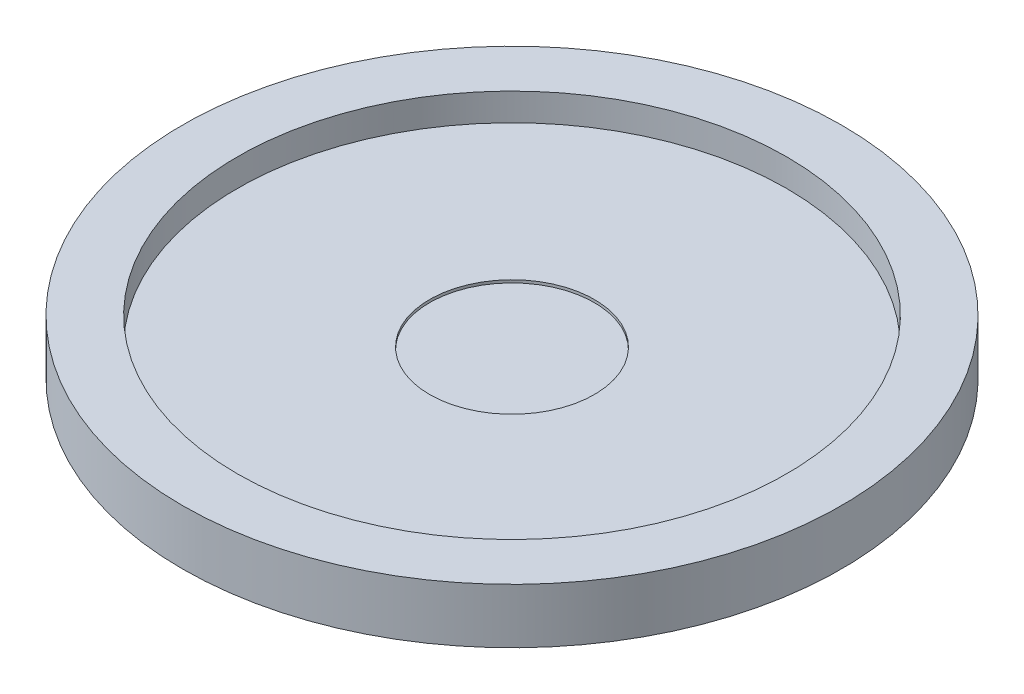
from build123d import *

# Parameters (mm, degrees)
SKETCH1_R           = 12000
BOSS_EXTRUDE1_DEPTH = 2000
SKETCH2_R           = 10000
CUT_EXTRUDE1_DEPTH  = 1000
SKETCH3_R           = 3000
CUT_EXTRUDE2_DEPTH  = 100


with BuildPart() as part:
    # Sketch1 → Boss-Extrude1 (new body)
    with BuildSketch(Plane(origin=(0, 0, 0), x_dir=(1, 0, 0), z_dir=(0, 1, 0))):
        Circle(SKETCH1_R)
    extrude(amount=BOSS_EXTRUDE1_DEPTH)

    # Sketch2 → Cut-Extrude1 (cut)
    with BuildSketch(Plane(origin=(0, 2000, 0), x_dir=(1, 0, 0), z_dir=(0, 1, 0))):
        Circle(SKETCH2_R)
    extrude(amount=-CUT_EXTRUDE1_DEPTH, mode=Mode.SUBTRACT)

    # Sketch3 → Cut-Extrude2 (cut)
    with BuildSketch(Plane(origin=(0, 1000, 0), x_dir=(1, 0, 0), z_dir=(0, 1, 0))):
        Circle(SKETCH3_R)
    extrude(amount=-CUT_EXTRUDE2_DEPTH, mode=Mode.SUBTRACT)


solid = part.part
